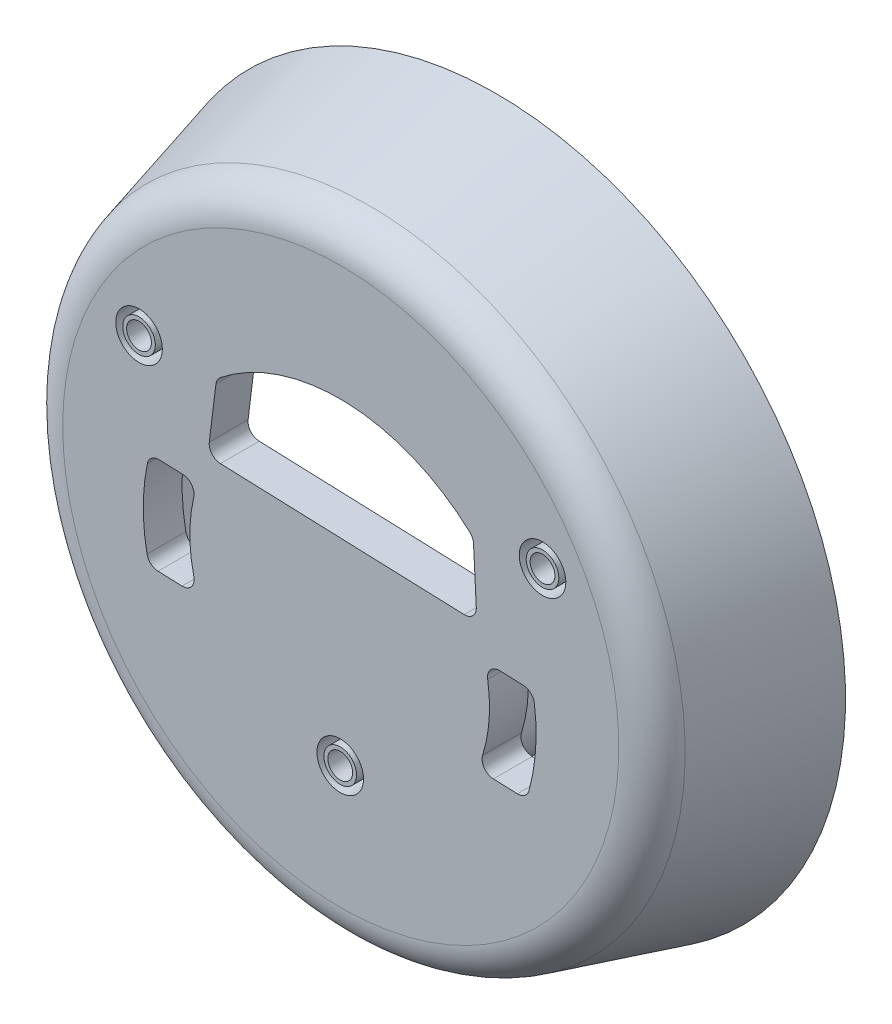
from build123d import *

# Parameters (mm, degrees)
CROQUIS2_R                   = 45
SALIENTE_EXTRUIR2_DEPTH      = 20
SALIENTE_EXTRUIR2_DRAFT      = -15
CORTAR_EXTRUIR2_REACH        = 152.409
VACIADO1_T                   = -5
CROQUIS3_R                   = 8
SALIENTE_EXTRUIR4_DEPTH      = 20
CROQUIS4_R                   = 3
CORTAR_EXTRUIR3_DEPTH        = 15
CROQUIS5_R                   = 1.6
CORTAR_EXTRUIR4_DEPTH        = 20
REDONDEO1_R                  = 5
EXTRUIR_L_MINA2_START        = -15
CROQUIS6_R                   = 2.1
CROQUIS6_R_2                 = 1.6
EXTRUIR_L_MINA2_DEPTH        = 15
CROQUIS8_R                   = 2.1
CROQUIS8_R_2                 = 1.6
CORTAR_EXTRUIR_L_MINA2_DEPTH = 0.2


with BuildPart() as part:
    # Croquis2 → Saliente-Extruir2 (with draft: the straight prism first)
    with BuildSketch(Plane(origin=(23.769597459, 178.821373691, 100), x_dir=(-0.9993352213470394, 0.03645703464715521, 0), z_dir=(0, 0, -1))):
        with Locations((0, -158.689221395)):
            Circle(CROQUIS2_R)
    extrude(amount=-SALIENTE_EXTRUIR2_DEPTH)
    # Saliente-Extruir2: the draft: its side faces are tilted about the plane it starts from
    saliente_extruir2_sides = [part.faces().sort_by_distance(p)[0] for p in [
        (62.954343977, 18.597078944, 110),
    ]]
    draft(saliente_extruir2_sides, Plane(origin=(23.769597459, 178.821373691, 100), x_dir=(-0.9993352213470394, 0.03645703464715521, 0), z_dir=(0, 0, -1)), SALIENTE_EXTRUIR2_DRAFT)

    # Croquis1 → Cortar-Extruir2 (cut, up to next)
    with BuildSketch(Plane.XY, mode=Mode.PRIVATE) as cortar_extruir2_sk1:
        with BuildLine():
            Line((38.437323763, 21.097738839), (41.485009265, 20.986555351))
            ThreePointArc((41.485009265, 20.986555351), (42.438890024, 20.597865086), (42.9171898, 19.685616244))
            ThreePointArc((42.9171898, 19.685616244), (43.079122698, 14.610532204), (42.224232033, 9.605348669))
            ThreePointArc((42.224232033, 9.605348669), (41.664976847, 8.795021667), (40.723770664, 8.506011054))
            Line((40.723770664, 8.506011054), (37.629680564, 8.618887441))
            ThreePointArc((37.629680564, 8.618887441), (36.459298216, 9.252321882), (36.253198954, 10.567067913))
            ThreePointArc((36.253198954, 10.567067913), (37.086559565, 14.928056242), (36.901106215, 19.364081058))
            ThreePointArc((36.901106215, 19.364081058), (37.259978414, 20.593539999), (38.437323763, 21.097738839))
        make_face()
    cortar_extruir2_tool1 = extrude(cortar_extruir2_sk1.sketch, amount=CORTAR_EXTRUIR2_REACH, mode=Mode.PRIVATE) & part.part
    # Croquis1 → Cortar-Extruir2 (cut, up to next)
    with BuildSketch(Plane.XY, mode=Mode.PRIVATE) as cortar_extruir2_sk2:
        with BuildLine():
            Line((35.078587083, 33.598032009), (35.432464356, 26.638122196))
            ThreePointArc((35.432464356, 26.638122196), (35.002635315, 25.508922895), (33.879713971, 25.062950115))
            Line((33.879713971, 25.062950115), (2.482656554, 26.208355166))
            ThreePointArc((2.482656554, 26.208355166), (1.395216267, 26.734964782), (1.048809592, 27.89248216))
            Line((1.048809592, 27.89248216), (1.908884166, 34.808105448))
            ThreePointArc((1.908884166, 34.808105448), (2.090402014, 35.358992606), (2.467347826, 35.799829589))
            ThreePointArc((2.467347826, 35.799829589), (18.746269299, 41.125348575), (34.59387052, 34.627812706))
            ThreePointArc((34.59387052, 34.627812706), (34.937692473, 34.160681188), (35.078587083, 33.598032009))
        make_face()
    cortar_extruir2_tool2 = extrude(cortar_extruir2_sk2.sketch, amount=CORTAR_EXTRUIR2_REACH, mode=Mode.PRIVATE) & part.part
    # Croquis1 → Cortar-Extruir2 (cut, up to next)
    with BuildSketch(Plane.XY, mode=Mode.PRIVATE) as cortar_extruir2_sk3:
        with BuildLine():
            Line((-2.351765549, 22.585777298), (-5.399451051, 22.696960786))
            ThreePointArc((-5.399451051, 22.696960786), (-6.379118323, 22.378808841), (-6.922618225, 21.503836566))
            ThreePointArc((-6.922618225, 21.503836566), (-7.453919699, 16.454042608), (-6.966007221, 11.399871886))
            ThreePointArc((-6.966007221, 11.399871886), (-6.467283625, 10.550948457), (-5.549638316, 10.19412455))
            Line((-5.549638316, 10.19412455), (-2.455548217, 10.081248162))
            ThreePointArc((-2.455548217, 10.081248162), (-1.242121436, 10.627718179), (-0.940770277, 11.923951766))
            ThreePointArc((-0.940770277, 11.923951766), (-1.454149603, 16.3340709), (-0.945955632, 20.74479057))
            ThreePointArc((-0.945955632, 20.74479057), (-1.214288606, 21.997130762), (-2.351765549, 22.585777298))
        make_face()
    cortar_extruir2_tool3 = extrude(cortar_extruir2_sk3.sketch, amount=CORTAR_EXTRUIR2_REACH, mode=Mode.PRIVATE) & part.part
    add(cortar_extruir2_tool1.solids().sort_by_distance((39.833877, 14.778214, 0))[0], mode=Mode.SUBTRACT)
    add(cortar_extruir2_tool2.solids().sort_by_distance((18.430411, 32.46725, 0))[0], mode=Mode.SUBTRACT)
    add(cortar_extruir2_tool3.solids().sort_by_distance((-4.205083, 16.384812, 0))[0], mode=Mode.SUBTRACT)

    # Vaciado1
    vaciado1_openings = [part.faces().sort_by_distance(p)[0] for p in [
        (37.259978414, 20.593539999, 110),
        (37.086559565, 14.928056242, 110),
        (36.459298216, 9.252321882, 110),
        (39.176725614, 8.562449247, 110),
        (41.664976847, 8.795021667, 110),
        (43.079122698, 14.610532204, 110),
        (42.438890024, 20.597865086, 110),
        (39.961166514, 21.042147095, 110),
        (-4.011135357, 16.390221893, 100),
        (35.002635315, 25.508922895, 110),
        (35.25552572, 30.118077102, 110),
        (34.937692473, 34.160681188, 110),
        (18.746269299, 41.125348575, 110),
        (2.090402014, 35.358992606, 110),
        (1.478846879, 31.350293804, 110),
        (1.395216267, 26.734964782, 110),
        (18.181185262, 25.635652641, 110),
        (-1.454149603, 16.3340709, 110),
        (-1.214288606, 21.997130762, 110),
        (-3.8756083, 22.641369042, 110),
        (-6.379118323, 22.378808841, 110),
        (-7.453919699, 16.454042608, 110),
        (-6.467283625, 10.550948457, 110),
        (-4.002593266, 10.137686356, 110),
        (-1.242121436, 10.627718179, 110),
    ]]
    offset(amount=VACIADO1_T, openings=vaciado1_openings, kind=Kind.INTERSECTION)

    # Croquis3 → Saliente-Extruir4 (add)
    with BuildSketch(Plane.XY.offset(120)):
        with Locations(Location((43.96502113, 35.237645503, 0), (0, 0, 341.483441436))):
            Circle(CROQUIS3_R)
        with Locations(Location((-7.996503097, 35.237645503, 0), (0, 0, 101.483441436))):
            Circle(CROQUIS3_R)
        with Locations(Location((17.913267573, 0.237771498, 0), (0, 0, 180))):
            Circle(CROQUIS3_R)
    extrude(amount=-SALIENTE_EXTRUIR4_DEPTH)

    # Croquis4 → Cortar-Extruir3 (cut)
    with BuildSketch(Plane.XY.offset(120)):
        with Locations((-7.996503097, 35.237645503)):
            Circle(CROQUIS4_R)
        with Locations((43.96502113, 35.237645503)):
            Circle(CROQUIS4_R)
        with Locations((17.913267573, 0.237771498)):
            Circle(CROQUIS4_R)
    extrude(amount=-CORTAR_EXTRUIR3_DEPTH, mode=Mode.SUBTRACT)

    # Croquis5 → Cortar-Extruir4 (cut)
    with BuildSketch(Plane.XY.offset(120)):
        with Locations(Location((-7.996503097, 35.237645503, 0), (0, 0, 180))):
            Circle(CROQUIS5_R)
        with Locations(Location((43.96502113, 35.237645503, 0), (0, 0, 180))):
            Circle(CROQUIS5_R)
        with Locations(Location((17.913267573, 0.237771498, 0), (0, 0, 180))):
            Circle(CROQUIS5_R)
    extrude(amount=-CORTAR_EXTRUIR4_DEPTH, mode=Mode.SUBTRACT)

    # Redondeo1
    redondeo1_edges = [part.edges().sort_by_distance(p)[0] for p in [
        (57.598922667, 18.792451603, 120),
    ]]
    fillet(redondeo1_edges, radius=REDONDEO1_R)

    # Croquis6 → Extruir-Lámina2 (add)
    # profile 1 of 3: a face of its own
    with BuildSketch(Plane.XY.offset(120).offset(EXTRUIR_L_MINA2_START)):
        with Locations((-7.996503097, 35.237645503)):
            Circle(CROQUIS6_R)
        with Locations((-7.996503097, 35.237645503)):
            Circle(CROQUIS6_R_2, mode=Mode.SUBTRACT)
    # profile 2 of 3: a face of its own
    with BuildSketch(Plane.XY.offset(120).offset(EXTRUIR_L_MINA2_START)):
        with Locations((43.96502113, 35.237645503)):
            Circle(CROQUIS6_R)
        with Locations((43.96502113, 35.237645503)):
            Circle(CROQUIS6_R_2, mode=Mode.SUBTRACT)
    # profile 3 of 3: a face of its own
    with BuildSketch(Plane.XY.offset(120).offset(EXTRUIR_L_MINA2_START)):
        with Locations((17.913267573, 0.237771498)):
            Circle(CROQUIS6_R)
        with Locations((17.913267573, 0.237771498)):
            Circle(CROQUIS6_R_2, mode=Mode.SUBTRACT)
    extrude(amount=EXTRUIR_L_MINA2_DEPTH)

    # Croquis8 → Cortar-Extruir-Lámina2 (cut)
    # profile 1 of 3: a face of its own
    with BuildSketch(Plane.XY.offset(105)):
        with Locations((-7.996503097, 35.237645503)):
            Circle(CROQUIS8_R)
        with Locations((-7.996503097, 35.237645503)):
            Circle(CROQUIS8_R_2, mode=Mode.SUBTRACT)
    # profile 2 of 3: a face of its own
    with BuildSketch(Plane.XY.offset(105)):
        with Locations((43.96502113, 35.237645503)):
            Circle(CROQUIS8_R)
        with Locations((43.96502113, 35.237645503)):
            Circle(CROQUIS8_R_2, mode=Mode.SUBTRACT)
    # profile 3 of 3: a face of its own
    with BuildSketch(Plane.XY.offset(105)):
        with Locations((17.913267573, 0.237771498)):
            Circle(CROQUIS8_R)
        with Locations((17.913267573, 0.237771498)):
            Circle(CROQUIS8_R_2, mode=Mode.SUBTRACT)
    extrude(amount=CORTAR_EXTRUIR_L_MINA2_DEPTH, mode=Mode.SUBTRACT)


with BuildPart() as cortar_extruir_l_mina2_piece_1:
    # of the separate pieces the step leaves, piece 1, a body of its own (cortar_extruir_l_mina2_pieces)
    add(part.part.solids().sort_by_distance((-22.622738704, 21.719041026, 116.294095226))[0])


with BuildPart() as cortar_extruir_l_mina2_piece_2:
    # of the separate pieces the step leaves, piece 2, a body of its own (cortar_extruir_l_mina2_pieces)
    add(part.part.solids().sort_by_distance((46.06502113, 35.237645503, 105.2))[0])


with BuildPart() as cortar_extruir_l_mina2_piece_3:
    # of the separate pieces the step leaves, piece 3, a body of its own (cortar_extruir_l_mina2_pieces)
    add(part.part.solids().sort_by_distance((20.013267573, 0.237771498, 105.2))[0])


with BuildPart() as cortar_extruir_l_mina2_piece_4:
    # of the separate pieces the step leaves, piece 4, a body of its own (cortar_extruir_l_mina2_pieces)
    add(part.part.solids().sort_by_distance((-5.896503097, 35.237645503, 105.2))[0])


solid = Compound([cortar_extruir_l_mina2_piece_1.part, cortar_extruir_l_mina2_piece_2.part, cortar_extruir_l_mina2_piece_3.part, cortar_extruir_l_mina2_piece_4.part])
